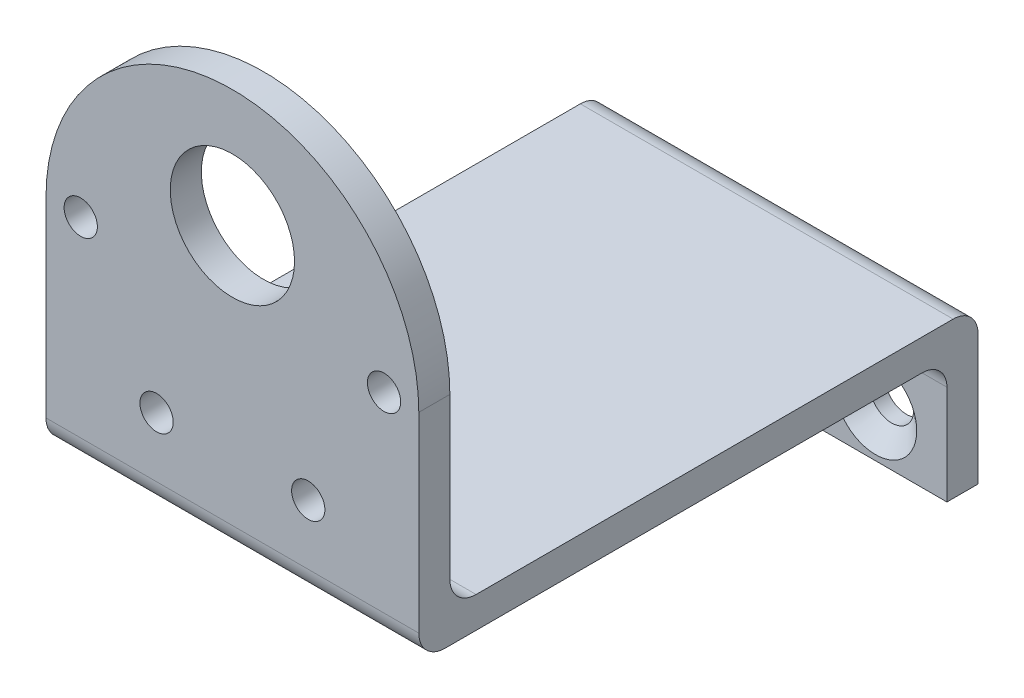
from build123d import *

# Parameters (mm, degrees)
BOSS_EXTRUDE1_DEPTH                       = 38.1
CSK_FOR_8_FLAT_HEAD_MACHINE_SCREW_2_COUNT = 2
CSK_FOR_8_FLAT_HEAD_MACHINE_SCREW_2_PITCH = 23.495
SKETCH11_R                                = 6.35
CUT_EXTRUDE1_DEPTH                        = 81.558479852
M3_CLEARANCE_HOLE1_D                      = 3.4


with BuildPart() as part:
    # Sketch1 → Boss-Extrude1 (new body)
    with BuildSketch(Plane(origin=(0, 0, 0), x_dir=(0, 0, -1), z_dir=(1, 0, 0))):
        with BuildLine():
            Line((0, 42.094372261), (0, 6.675328802))
            ThreePointArc((0, 6.675328802), (0.785233991, 4.779606252), (2.680956542, 3.994372261))
            Line((2.680956542, 3.994372261), (51.435, 3.994372261))
            ThreePointArc((51.435, 3.994372261), (53.231051224, 3.250423485), (53.975, 1.454372261))
            Line((53.975, 1.454372261), (53.975, -11.880627739))
            Line((53.975, -11.880627739), (50.8, -11.880627739))
            Line((50.8, -11.880627739), (50.8, -1.720627739))
            ThreePointArc((50.8, -1.720627739), (50.056051224, 0.075423485), (48.26, 0.819372261))
            Line((48.26, 0.819372261), (-0.494043458, 0.819372261))
            ThreePointArc((-0.494043458, 0.819372261), (-2.389766009, 1.604606252), (-3.175, 3.500328802))
            Line((-3.175, 3.500328802), (-3.175, 42.094372261))
            Line((-3.175, 42.094372261), (0, 42.094372261))
        make_face()
    extrude(amount=BOSS_EXTRUDE1_DEPTH)

    # Sketch10 → CSK for #8 Flat Head Machine Screw (100)2 (revolve, cut)
    with BuildSketch(Plane(origin=(7.3025, -7.118127739, -50.8), x_dir=(0, -1, 0), z_dir=(1, 0, 0))):
        Polygon((0, 0), (0, 3.175), (2.2479, 3.175), (2.2479, 1.651767624), (4.2164, 0), align=None)
    csk_for_8_flat_head_machine_screw_100 = revolve(axis=Axis((7.3025, -7.118127739, -44.45), (0, 0, -1)), mode=Mode.SUBTRACT)

    # CSK for _8 Flat Head Machine Screw _ 2: CSK for #8 Flat Head Machine Screw (100)2 ×2
    with Locations(*[(i * CSK_FOR_8_FLAT_HEAD_MACHINE_SCREW_2_PITCH, 0, 0) for i in range(1, CSK_FOR_8_FLAT_HEAD_MACHINE_SCREW_2_COUNT)]):
        add(csk_for_8_flat_head_machine_screw_100, mode=Mode.SUBTRACT)

    # Sketch11 → Cut-Extrude1 (cut, through all)
    with BuildSketch(Plane.XY.offset(3.175)):
        with BuildLine():
            Line((38.1, 42.094372261), (19.05, 42.094372261))
            ThreePointArc((19.05, 42.094372261), (32.520384182, 36.514756442), (38.1, 23.044372261))
            Line((38.1, 23.044372261), (38.1, 42.094372261))
        make_face()
        with BuildLine():
            Line((0, 42.094372261), (0, 23.044372261))
            ThreePointArc((0, 23.044372261), (5.579615818, 36.514756442), (19.05, 42.094372261))
            Line((19.05, 42.094372261), (0, 42.094372261))
        make_face()
        with Locations((19.05, 30.044372261)):
            Circle(SKETCH11_R)
    extrude(amount=-CUT_EXTRUDE1_DEPTH, mode=Mode.SUBTRACT)

    # M3 Clearance Hole1 (through all)
    with Locations(Plane.XY.offset(3.175)):
        with Locations((3.55, 23.044372261), (34.55, 23.044372261), (26.8, 9.620978502), (11.3, 9.620978502)):
            Hole(M3_CLEARANCE_HOLE1_D / 2)


solid = part.part
